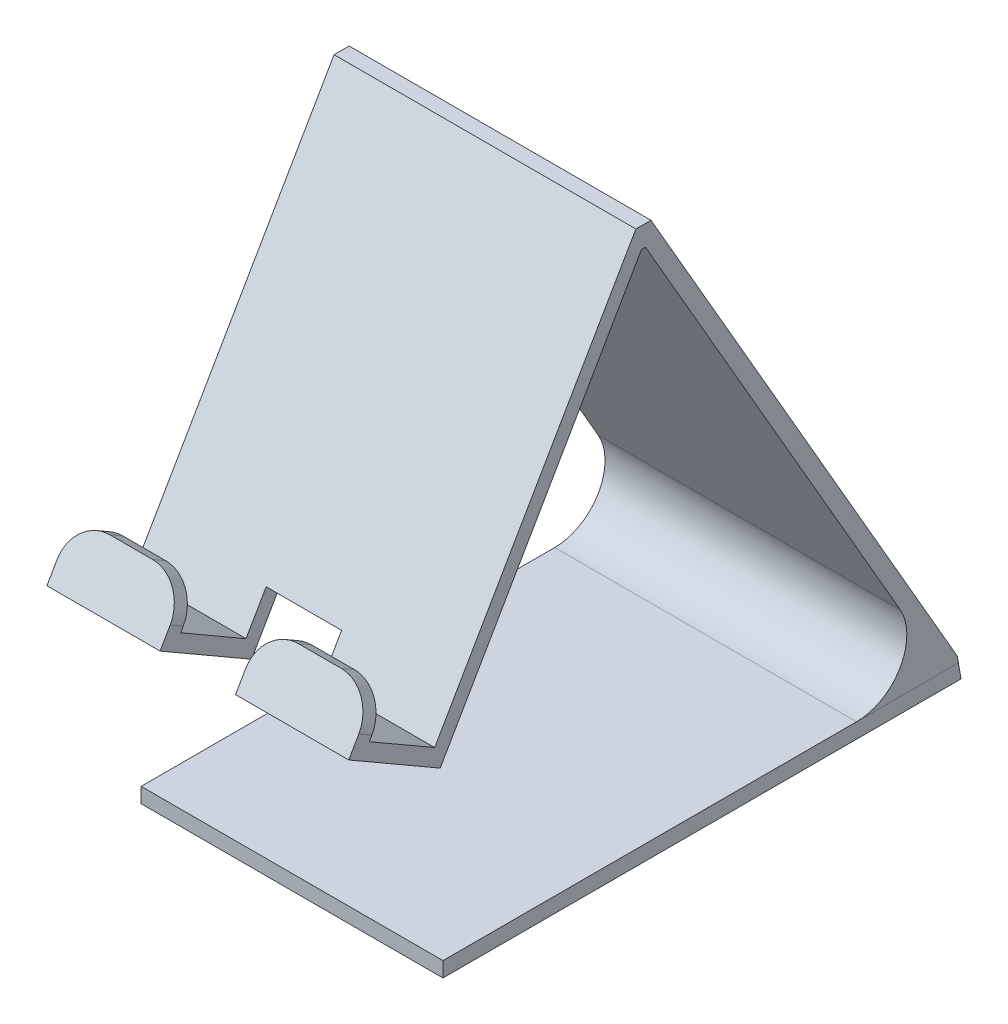
from build123d import *

# Parameters (mm, degrees)
SKETCH1_W           = 60
SKETCH1_H           = 103
BOSS_EXTRUDE1_DEPTH = 3
BASE_FLANGE1_DEPTH  = 60
TAB2_DEPTH          = 60
SKETCH15_W          = 15
SKETCH15_H          = 11
CUT_EXTRUDE2_DEPTH  = 29
SKETCH16_W          = 22.5
SKETCH16_H          = 8
BOSS_EXTRUDE2_DEPTH = 3
FILLET1_R           = 7
CUT_EXTRUDE3_DEPTH  = 90


# Sheet-metal steps are written as plain solids
with BuildPart() as part:
    # Sketch1 → Boss-Extrude1 (new body)
    with BuildSketch(Plane(origin=(0, 0, 0), x_dir=(1, 0, 0), z_dir=(0, 1, 0))):
        Rectangle(SKETCH1_W, SKETCH1_H)
    extrude(amount=BOSS_EXTRUDE1_DEPTH)


with BuildPart() as body_2:
    # Sketch3 → Base-Flange1 (new body)
    with BuildSketch(Plane(origin=(30, 0, 0), x_dir=(0, 0, -1), z_dir=(1, 0, 0))):
        with BuildLine():
            Line((51.5, 3), (-8.651739219, 107.185868491))
            Line((-8.651739219, 107.185868491), (-11.249815431, 105.685868491))
            Line((-11.249815431, 105.685868491), (39.375644347, 18))
            ThreePointArc((39.375644347, 18), (39.375644347, 8), (30.715390309, 3))
            Line((30.715390309, 3), (48.035898385, 3))
            Line((48.035898385, 3), (51.5, 3))
        make_face()
    extrude(amount=-BASE_FLANGE1_DEPTH)

    # Sketch8 → Tab2 (add)
    with BuildSketch(Plane(origin=(30, 0, 0), x_dir=(0, 0, -1), z_dir=(1, 0, 0))):
        Polygon((-14.651739219, 107.185868491), (-13.151739219, 109.783944703), (-10.151739219, 109.783944703), (-8.651739219, 107.185868491), (-11.249815431, 105.685868491), (-12.053663008, 105.685868491), (-52.053663008, 36.403836188), (-54.651739219, 37.903836188), (-67.642120276, 45.403836188), (-70.240196487, 46.903836188), (-68.740196487, 49.5019124), (-66.142120276, 48.0019124), (-53.151739219, 40.5019124), align=None)
    extrude(amount=-TAB2_DEPTH)

    # Sketch15 → Cut-Extrude2 (cut, symmetric)
    with BuildSketch(Plane(origin=(0, 33.14085631, 57.401646934), x_dir=(1, 0, 0), z_dir=(0, 0.5000000000000021, 0.8660254037844374))):
        with Locations((0, 10.999815431)):
            Rectangle(SKETCH15_W, SKETCH15_H)
    extrude(amount=CUT_EXTRUDE2_DEPTH, both=True, mode=Mode.SUBTRACT)

    # Sketch16 → Boss-Extrude2 (add)
    with BuildSketch(Plane(origin=(0, 42.14085631, 72.990104203), x_dir=(1, 0, 0), z_dir=(0, 0.4999999999999961, 0.866025403784441))):
        with Locations((-18.75, 12.499815431)):
            Rectangle(SKETCH16_W, SKETCH16_H)
        with Locations((18.75, 12.499815431)):
            Rectangle(SKETCH16_W, SKETCH16_H)
    extrude(amount=-BOSS_EXTRUDE2_DEPTH)

    # Fillet1
    fillet1_edges = [body_2.edges().sort_by_distance(p)[0] for p in [
        (-30, 55.68011563, 63.441158382),
        (-7.5, 55.68011563, 63.441158382),
        (7.5, 55.68011563, 63.441158382),
        (30, 55.68011563, 63.441158382),
    ]]
    fillet(fillet1_edges, radius=FILLET1_R)


with BuildPart() as cut_extrude3_tool:
    # Sketch17 → Cut-Extrude3 (new body)
    with BuildSketch(Plane(origin=(30, 0, 0), x_dir=(0, 0, -1), z_dir=(1, 0, 0))):
        Polygon((51.5, 0), (50.738430041, 4.319077862), (51.5, 3), align=None)
    extrude(amount=-CUT_EXTRUDE3_DEPTH)


with BuildPart() as part_1:
    add(part.part)

    # Cut-Extrude3: cut by cut_extrude3_tool
    add(cut_extrude3_tool.part, mode=Mode.SUBTRACT)


with BuildPart() as body_2_1:
    add(body_2.part)

    # Cut-Extrude3: cut by cut_extrude3_tool
    add(cut_extrude3_tool.part, mode=Mode.SUBTRACT)


solid = Compound([part_1.part, body_2_1.part])
